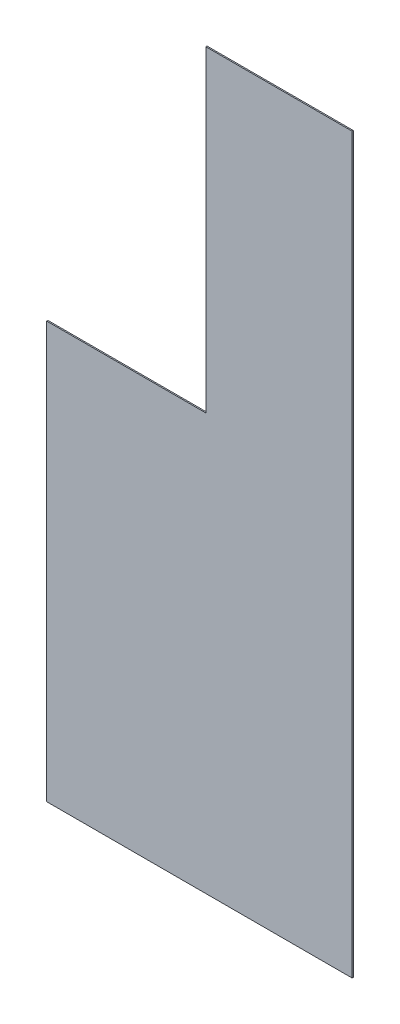
from build123d import *

# Parameters (mm, degrees)
TABAN_FLAN_1_DEPTH = 10


# Sheet-metal steps are written as plain solids
with BuildPart() as part:
    # Çizim1 → Taban-Flanş1 (new body)
    with BuildSketch(Plane.XY):
        Polygon((0, 0), (0, 3415), (1305, 3415), (1305, 6017), (2505, 6017), (2505, 0), align=None)
    extrude(amount=-TABAN_FLAN_1_DEPTH)


solid = part.part
